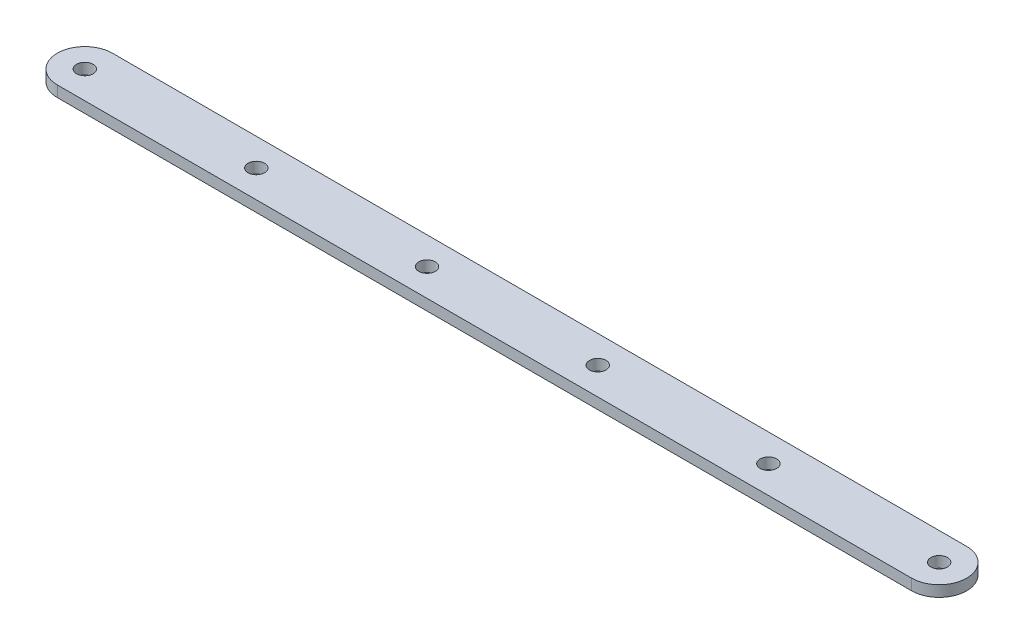
from build123d import *

# Parameters (mm, degrees)
SKETCH1_R           = 3.01
BOSS_EXTRUDE1_DEPTH = 4


with BuildPart() as part:
    # Sketch1 → Boss-Extrude1 (new body)
    with BuildSketch(Plane(origin=(0, 0, 0), x_dir=(1, 0, 0), z_dir=(0, 1, 0))):
        with BuildLine():
            Line((-186.4, 10), (124.05, 10))
            ThreePointArc((124.05, 10), (134.05, 0), (124.05, -10))
            Line((124.05, -10), (-186.4, -10))
            ThreePointArc((-186.4, -10), (-196.4, 0), (-186.4, 10))
        make_face()
        with Locations((-186.4, 0)):
            Circle(SKETCH1_R, mode=Mode.SUBTRACT)
        with Locations((-124.1, 0)):
            Circle(SKETCH1_R, mode=Mode.SUBTRACT)
        with Locations((-62.05, 0)):
            Circle(SKETCH1_R, mode=Mode.SUBTRACT)
        Circle(SKETCH1_R, mode=Mode.SUBTRACT)
        with Locations((62, 0)):
            Circle(SKETCH1_R, mode=Mode.SUBTRACT)
        with Locations((124.05, 0)):
            Circle(SKETCH1_R, mode=Mode.SUBTRACT)
    extrude(amount=BOSS_EXTRUDE1_DEPTH)


solid = part.part
